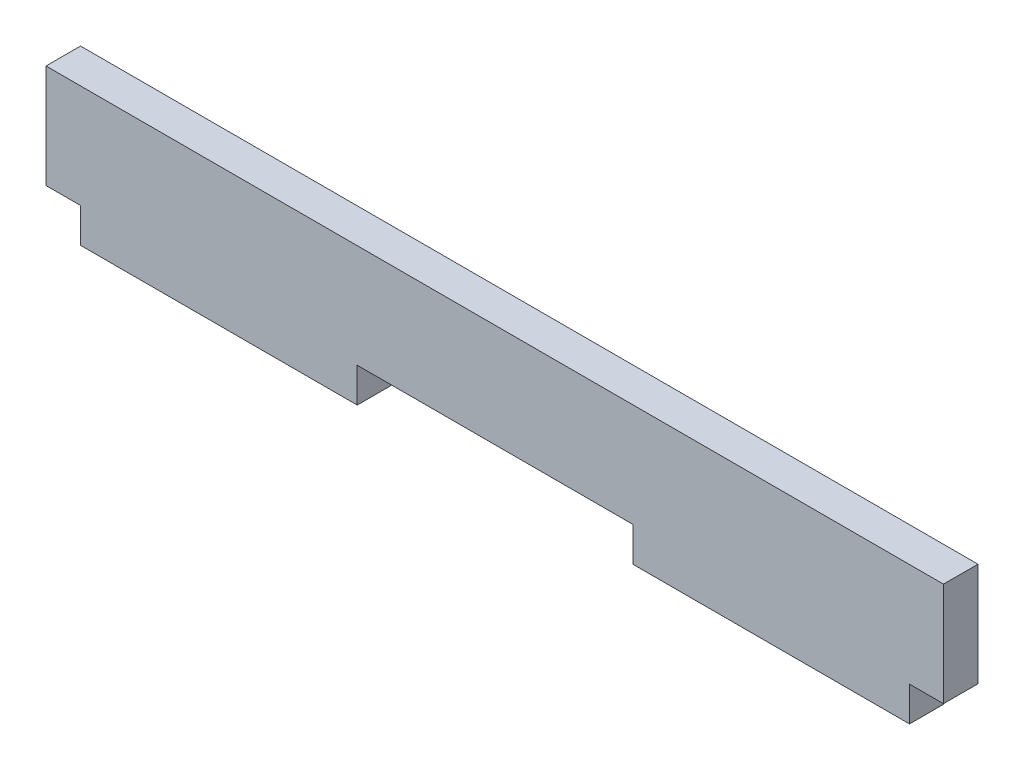
from build123d import *

# Parameters (mm, degrees)
BOSS_EXTRUDE1_DEPTH = 1.5875


with BuildPart() as part:
    # Sketch1 → Boss-Extrude1 (new, symmetric)
    with BuildSketch(Plane.XY):
        Polygon((-12.6492, -4.7625), (12.7, -4.7625), (12.7, -7.9375), (38.1508, -7.9375), (38.1508, -4.7625), (41.275, -4.7625), (41.275, 4.7625), (-41.275, 4.7625), (-41.275, -4.7625), (-38.1, -4.7625), (-38.1, -7.9375), (-12.6492, -7.9375), align=None)
    extrude(amount=BOSS_EXTRUDE1_DEPTH, both=True)


solid = part.part
